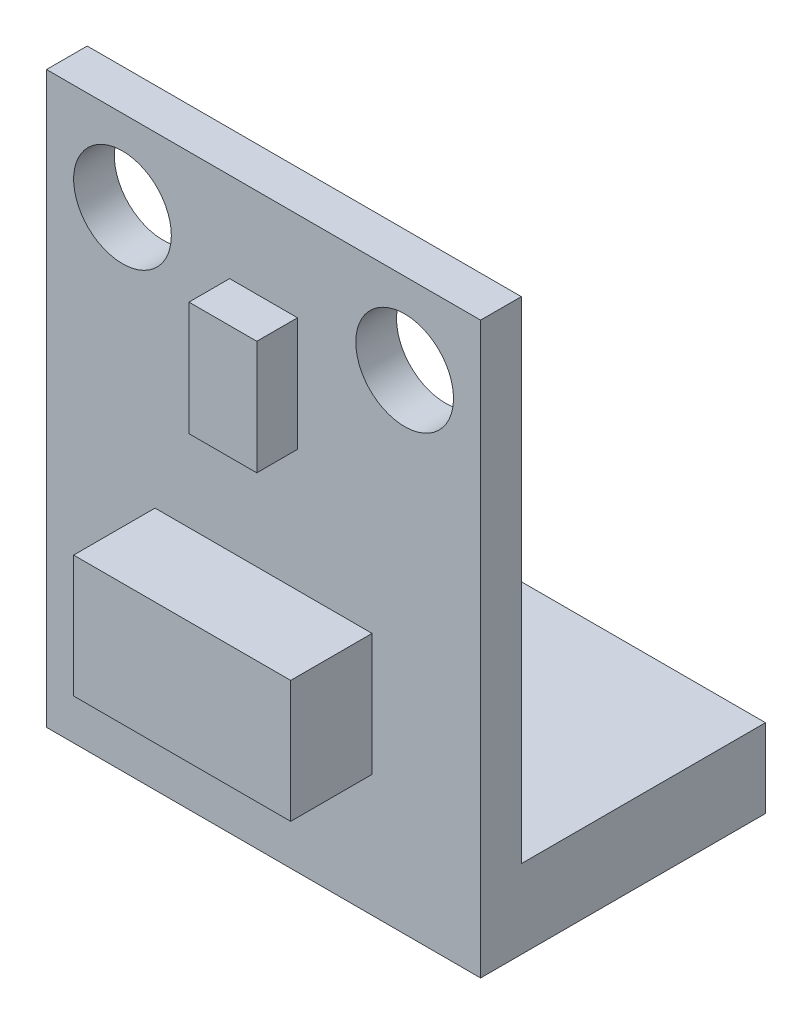
from build123d import *

# Parameters (mm, degrees)
SKETCH1_W           = 16
SKETCH1_H           = 21
SKETCH1_R           = 1.8
BOSS_EXTRUDE1_DEPTH = 1.5
SKETCH2_W           = 2.5
SKETCH2_H           = 4.2
BOSS_EXTRUDE2_DEPTH = 1.5
SKETCH3_W           = 8
SKETCH3_H           = 4.5
BOSS_EXTRUDE3_DEPTH = 3
SKETCH4_W           = 16
SKETCH4_H           = 2.9
BOSS_EXTRUDE4_DEPTH = 9


with BuildPart() as part:
    # Sketch1 → Boss-Extrude1 (new body)
    with BuildSketch(Plane.XY):
        Rectangle(SKETCH1_W, SKETCH1_H)
        with Locations((-5.2, 7.5)):
            Circle(SKETCH1_R, mode=Mode.SUBTRACT)
        with Locations((5.2, 7.5)):
            Circle(SKETCH1_R, mode=Mode.SUBTRACT)
    extrude(amount=BOSS_EXTRUDE1_DEPTH)

    # Sketch2 → Boss-Extrude2 (add)
    with BuildSketch(Plane.XY.offset(1.5)):
        with Locations((0, 5.1)):
            Rectangle(SKETCH2_W, SKETCH2_H)
    extrude(amount=BOSS_EXTRUDE2_DEPTH)

    # Sketch3 → Boss-Extrude3 (add)
    with BuildSketch(Plane.XY.offset(1.5)):
        with Locations((0, -3.75)):
            Rectangle(SKETCH3_W, SKETCH3_H)
    extrude(amount=BOSS_EXTRUDE3_DEPTH)

    # Sketch4 → Boss-Extrude4 (add)
    with BuildSketch(Plane(origin=(0, 0, 0), x_dir=(-1, 0, 0), z_dir=(0, 0, -1))):
        with Locations((0, -9.05)):
            Rectangle(SKETCH4_W, SKETCH4_H)
    extrude(amount=BOSS_EXTRUDE4_DEPTH)


solid = part.part
